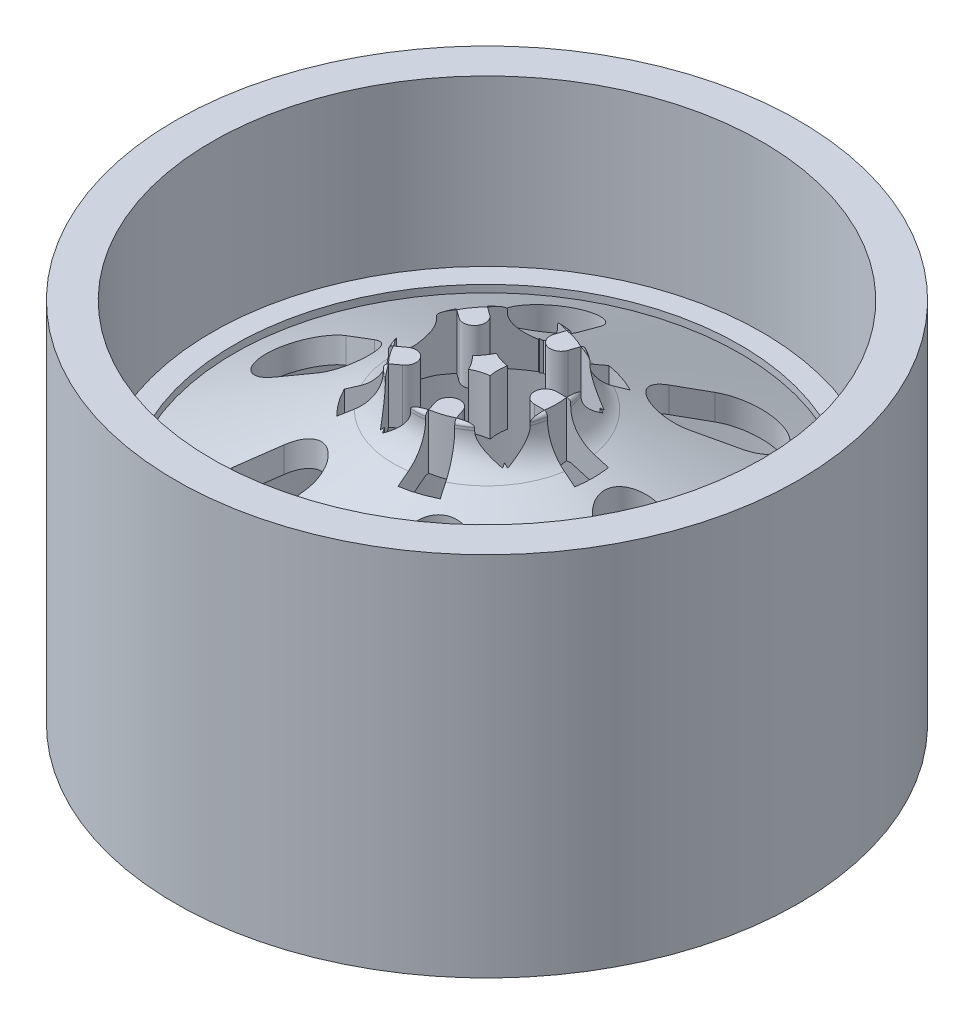
from build123d import *

# Parameters (mm, degrees)
FILLET_1_R           = 10
FILLET_2_R           = 1
CUT_EXTRUDE_4_DEPTH  = 131.192165663
CUT_EXTRUDE_START    = 15.591836735
CUT_EXTRUDE_18_DEPTH = 19.408163265


# Read off the part's stored shape, not the designer's step: 切除-拉伸-薄壁18
with BuildPart() as part:
    # 草图1 → 旋转1 (revolve)
    with BuildSketch(Plane.XY):
        Polygon((0, 35), (20, 35), (20, 27), (69, 3), (69, 5), (75, 5), (75, 50), (85, 50), (85, -50), (75, -50), (75, -6), (69, -6), (69, -4), (20, 20), (0, 20), align=None)
    revolve(axis=Axis((0, 20, 0), (0, 1, 0)))

    # 圆角1
    fillet_1_edges = [part.edges().sort_by_distance(p)[0] for p in [
        (-20, 27, 0),
    ]]
    fillet(fillet_1_edges, radius=FILLET_1_R)

    # 圆角2
    fillet_2_edges = [part.edges().sort_by_distance(p)[0] for p in [
        (-20, 35, 0),
    ]]
    fillet(fillet_2_edges, radius=FILLET_2_R)

    # 草图2 → 切除-拉伸4 (cut, through all)
    with BuildSketch(Plane(origin=(0, 0, 0), x_dir=(1, 0, 0), z_dir=(0, 1, 0))):
        with BuildLine():
            Line((38.418900428, 7.904268762), (48.221652285, 9.880643228))
            ThreePointArc((48.221652285, 9.880643228), (60.198014712, 0.093408171), (48.252083234, -9.730946677))
            Line((48.252083234, -9.730946677), (38.443245187, -7.785003161))
            ThreePointArc((38.443245187, -7.785003161), (32.000009631, 0.049653836), (38.418900428, 7.904268762))
        make_face()
        with BuildLine():
            Line((26.054747761, -29.319609375), (32.667714183, -36.820854278))
            ThreePointArc((32.667714183, -36.820854278), (30.179901205, -52.086305912), (15.698794592, -46.653003205))
            Line((15.698794592, -46.653003205), (12.479612088, -37.185328517))
            ThreePointArc((12.479612088, -37.185328517), (16.043006299, -27.687994344), (26.054747761, -29.319609375))
        make_face()
        with BuildLine():
            Line((-12.364152667, -37.223878137), (-15.553938102, -46.701497505))
            ThreePointArc((-15.553938102, -46.701497505), (-30.018113507, -52.179714083), (-32.553288642, -36.922056528))
            Line((-32.553288642, -36.922056528), (-25.9636331, -29.400325356))
            ThreePointArc((-25.9636331, -29.400325356), (-15.957003332, -27.73764818), (-12.364152667, -37.223878137))
        make_face()
        with BuildLine():
            Line((-38.418900428, -7.904268762), (-48.221652285, -9.880643228))
            ThreePointArc((-48.221652285, -9.880643228), (-60.198014712, -0.093408171), (-48.252083234, 9.730946677))
            Line((-48.252083234, 9.730946677), (-38.443245187, 7.785003161))
            ThreePointArc((-38.443245187, 7.785003161), (-32.000009631, -0.049653836), (-38.418900428, -7.904268762))
        make_face()
        with BuildLine():
            Line((-26.054747761, 29.319609375), (-32.667714183, 36.820854278))
            ThreePointArc((-32.667714183, 36.820854278), (-30.179901205, 52.086305912), (-15.698794592, 46.653003205))
            Line((-15.698794592, 46.653003205), (-12.479612088, 37.185328517))
            ThreePointArc((-12.479612088, 37.185328517), (-16.043006299, 27.687994344), (-26.054747761, 29.319609375))
        make_face()
        with BuildLine():
            Line((12.364152667, 37.223878137), (15.553938102, 46.701497505))
            ThreePointArc((15.553938102, 46.701497505), (30.018113507, 52.179714083), (32.553288642, 36.922056528))
            Line((32.553288642, 36.922056528), (25.9636331, 29.400325356))
            ThreePointArc((25.9636331, 29.400325356), (15.957003332, 27.73764818), (12.364152667, 37.223878137))
        make_face()
    extrude(amount=CUT_EXTRUDE_4_DEPTH, mode=Mode.SUBTRACT)

    # 切除-拉伸-薄壁18 outline → 切除-拉伸-薄壁18 (cut)
    # profile 1 of 6: a face of its own
    with BuildSketch(Plane(origin=(0, 0, 0), x_dir=(1, 0, 0), z_dir=(0, 1, 0)).offset(CUT_EXTRUDE_START)):
        with BuildLine():
            ThreePointArc((28.619235152, -4.683949117), (28.999805046, -0.106335646), (28.652815055, 4.47394562))
            Line((28.652815055, 4.47394562), (18.772534002, 2.931205751))
            ThreePointArc((18.772534002, 2.931205751), (18.999872272, -0.069668182), (18.750533375, -3.068794249))
            Line((18.750533375, -3.068794249), (28.619235152, -4.683949117))
        make_face()
    # profile 2 of 6: a face of its own
    with BuildSketch(Plane(origin=(0, 0, 0), x_dir=(1, 0, 0), z_dir=(0, 1, 0)).offset(CUT_EXTRUDE_START)):
        with BuildLine():
            Line((15.999852104, 2.931205751), (18.772534002, 2.931205751))
            Line((18.772534002, 2.931205751), (18.772534002, 12.931205751))
            Line((18.772534002, 12.931205751), (17.942946914, 12.931205751))
            Line((17.942946914, 12.931205751), (18.223395397, 13.794337432))
            Line((18.223395397, 13.794337432), (8.712830234, 16.884507375))
            Line((8.712830234, 16.884507375), (7.862822975, 14.268454028))
            ThreePointArc((7.862822975, 14.268454028), (4.082602443, 12.342335462), (2.156483877, 16.122555994))
            Line((2.156483877, 16.122555994), (3.013289704, 18.759533181))
            Line((3.013289704, 18.759533181), (-6.497275459, 21.849703125))
            Line((-6.497275459, 21.849703125), (-6.753631968, 21.060718919))
            Line((-6.753631968, 21.060718919), (-7.487855629, 21.594163634))
            Line((-7.487855629, 21.594163634), (-13.365708152, 13.50399369))
            Line((-13.365708152, 13.50399369), (-11.140360258, 11.887183805))
            ThreePointArc((-11.140360258, 11.887183805), (-10.476665032, 7.696777065), (-14.667071772, 7.033081839))
            Line((-14.667071772, 7.033081839), (-16.910218547, 8.662823368))
            Line((-16.910218547, 8.662823368), (-22.78807107, 0.572653424))
            Line((-22.78807107, 0.572653424), (-22.116921017, 0.085034368))
            Line((-22.116921017, 0.085034368), (-22.851144679, -0.448410347))
            Line((-22.851144679, -0.448410347), (-16.973292156, -8.538580291))
            Line((-16.973292156, -8.538580291), (-14.747944261, -6.921770406))
            ThreePointArc((-14.747944261, -6.921770406), (-10.557537521, -7.585465632), (-11.221232748, -11.775872372))
            Line((-11.221232748, -11.775872372), (-13.464379523, -13.405613901))
            Line((-13.464379523, -13.405613901), (-7.586527, -21.495783845))
            Line((-7.586527, -21.495783845), (-6.915376947, -21.008164789))
            Line((-6.915376947, -21.008164789), (-6.634928464, -21.871296469))
            Line((-6.634928464, -21.871296469), (2.875636699, -18.781126526))
            Line((2.875636699, -18.781126526), (2.02562944, -16.165073178))
            ThreePointArc((2.02562944, -16.165073178), (3.951748006, -12.384852646), (7.731968538, -14.310971212))
            Line((7.731968538, -14.310971212), (8.588774364, -16.947948399))
            Line((8.588774364, -16.947948399), (18.099339527, -13.857778455))
            Line((18.099339527, -13.857778455), (17.842983019, -13.068794249))
            Line((17.842983019, -13.068794249), (18.750533375, -13.068794249))
            Line((18.750533375, -13.068794249), (18.750533375, -3.068794249))
            Line((18.750533375, -3.068794249), (15.999852104, -3.068794249))
            ThreePointArc((15.999852104, -3.068794249), (12.999852104, -0.068794249), (15.999852104, 2.931205751))
        make_face()
        with BuildLine():
            ThreePointArc((-1.210269677, 3.780052476), (0.939310017, 2.84915719), (3.221049641, 2.319135317))
            ThreePointArc((3.221049641, 2.319135317), (2.99997227, -0.012898922), (3.200987834, -2.346748025))
            ThreePointArc((3.200987834, -2.346748025), (0.91477481, -2.857129162), (-1.242730362, -3.76950536))
            ThreePointArc((-1.242730362, -3.76950536), (-2.434610345, -1.752904011), (-3.969037437, 0.017065592))
            ThreePointArc((-3.969037437, 0.017065592), (-2.419446753, 1.773774904), (-1.210269677, 3.780052476))
        make_face(mode=Mode.SUBTRACT)
    # profile 3 of 6: a face of its own
    with BuildSketch(Plane(origin=(0, 0, 0), x_dir=(1, 0, 0), z_dir=(0, 1, 0)).offset(CUT_EXTRUDE_START)):
        with BuildLine():
            ThreePointArc((3.013289704, 18.759533181), (5.937541801, 18.048423681), (8.712830234, 16.884507375))
            Line((8.712830234, 16.884507375), (13.298530357, 25.771090205))
            ThreePointArc((13.298530357, 25.771090205), (9.062563802, 27.547594039), (4.599231653, 28.632971697))
            Line((4.599231653, 28.632971697), (3.013289704, 18.759533181))
        make_face()
    # profile 4 of 6: a face of its own
    with BuildSketch(Plane(origin=(0, 0, 0), x_dir=(1, 0, 0), z_dir=(0, 1, 0)).offset(CUT_EXTRUDE_START)):
        with BuildLine():
            ThreePointArc((8.588774364, -16.947948399), (5.805025044, -18.091480985), (2.875636699, -18.781126526))
            Line((2.875636699, -18.781126526), (4.389129698, -28.66592996))
            ThreePointArc((4.389129698, -28.66592996), (8.860301383, -27.613313082), (13.109181924, -25.86792124))
            Line((13.109181924, -25.86792124), (8.588774364, -16.947948399))
        make_face()
    # profile 5 of 6: a face of its own
    with BuildSketch(Plane(origin=(0, 0, 0), x_dir=(1, 0, 0), z_dir=(0, 1, 0)).offset(CUT_EXTRUDE_START)):
        with BuildLine():
            ThreePointArc((-16.910218547, 8.662823368), (-15.330269629, 11.22420746), (-13.365708152, 13.50399369))
            Line((-13.365708152, 13.50399369), (-20.40029139, 20.61135879))
            ThreePointArc((-20.40029139, 20.61135879), (-23.398832591, 17.131685071), (-25.810333571, 13.222204088))
            Line((-25.810333571, 13.222204088), (-16.910218547, 8.662823368))
        make_face()
    # profile 6 of 6: a face of its own
    with BuildSketch(Plane(origin=(0, 0, 0), x_dir=(1, 0, 0), z_dir=(0, 1, 0)).offset(CUT_EXTRUDE_START)):
        with BuildLine():
            ThreePointArc((-13.464379523, -13.405613901), (-15.412169489, -11.111481974), (-16.973292156, -8.538580291))
            Line((-16.973292156, -8.538580291), (-25.906603817, -13.032569918))
            ThreePointArc((-25.906603817, -13.032569918), (-23.523837641, -16.959630381), (-20.550895061, -20.461200165))
            Line((-20.550895061, -20.461200165), (-13.464379523, -13.405613901))
        make_face()
    extrude(amount=CUT_EXTRUDE_18_DEPTH, mode=Mode.SUBTRACT)


solid = part.part
